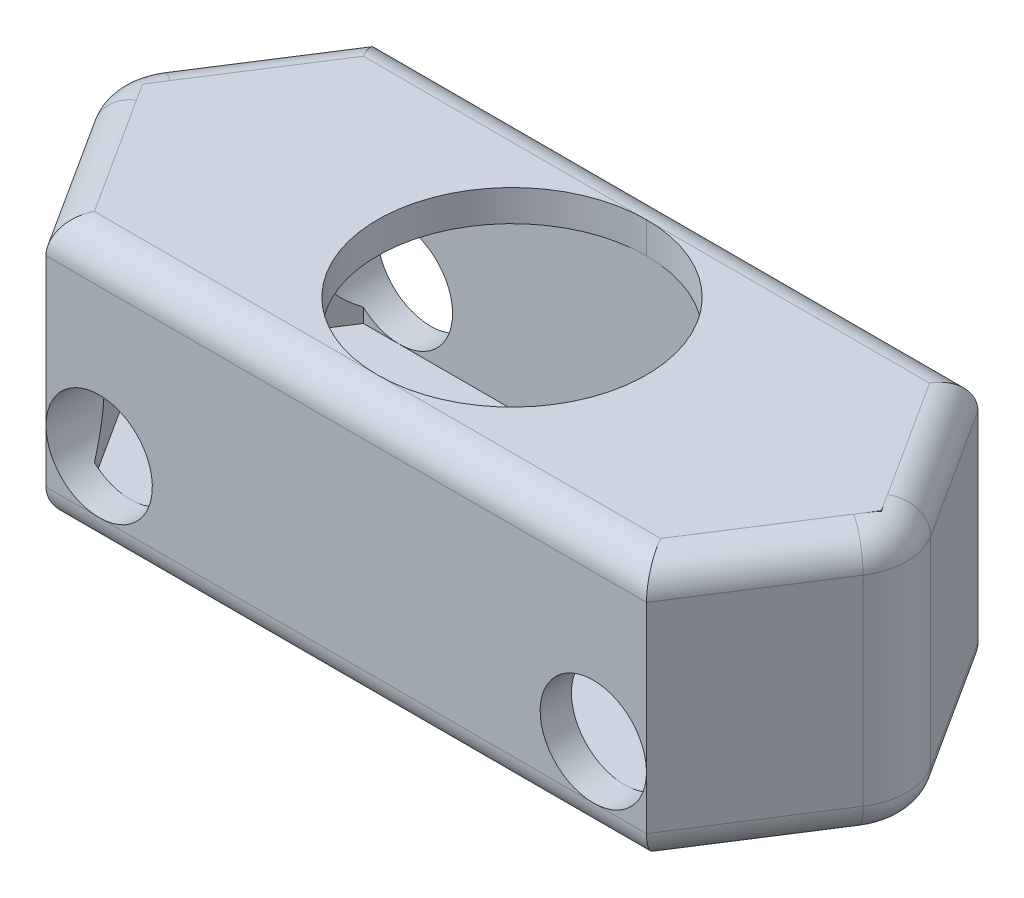
from build123d import *

# Parameters (mm, degrees)
SKETCH1_W           = 96
SKETCH1_H           = 53
BOSS_EXTRUDE1_DEPTH = 42
BOSS_EXTRUDE2_DEPTH = 42
SHELL5_T            = -5
CUT_EXTRUDE2_DEPTH  = 1
FILLET1_R           = 10
FILLET3_R           = 5
SKETCH10_R          = 8.5
CUT_EXTRUDE3_DEPTH  = 93.50423389
BOSS_EXTRUDE3_DEPTH = 5


with BuildPart() as part:
    # Sketch1 → Boss-Extrude1 (new body)
    with BuildSketch(Plane(origin=(0, 0, 0), x_dir=(1, 0, 0), z_dir=(0, 1, 0))):
        Rectangle(SKETCH1_W, SKETCH1_H)
    extrude(amount=BOSS_EXTRUDE1_DEPTH)

    # Sketch3 → Boss-Extrude2 (add)
    with BuildSketch(Plane.XZ):
        Polygon((48, -26.5), (65, 0), (48, 26.5), align=None)
        Polygon((-48, 26.5), (-65, 0), (-48, -26.5), align=None)
    extrude(amount=-BOSS_EXTRUDE2_DEPTH)

    # Shell5
    shell5_openings = [part.faces().sort_by_distance(p)[0] for p in [
        (0, 42, 0),
    ]]
    offset(amount=SHELL5_T, openings=shell5_openings, kind=Kind.INTERSECTION)

    # Sketch8 → Cut-Extrude2 (cut)
    # profile 1 of 6: a face of its own
    with BuildSketch(Plane(origin=(0, 5, 0), x_dir=(1, 0, 0), z_dir=(0, 1, 0))):
        with BuildLine():
            Line((-4.504844961, 1.050715732), (-4.844889031, 0.754842335))
            add(Edge.make_bspline(
                [(-4.844889031, 0.754842335), (-4.898237291, 0.80142613), (-5.002092405, 0.892112602), (-5.164707572, 1.011904887), (-5.328232657, 1.112946399), (-5.492710957, 1.194030907), (-5.655366137, 1.258974286), (-5.816939379, 1.303622633), (-5.976145971, 1.332792074), (-6.082014719, 1.336396961), (-6.134252012, 1.338175668)],
                knots=[0, 0, 0, 0, 1.174203348, 2.285866929, 3.345479548, 4.357773815, 5.323690501, 6.245291137, 7.134199255, 8, 8, 8, 8], degree=3))
            add(Edge.make_bspline(
                [(-6.134252012, 1.338175668), (-6.164425447, 1.337703009), (-6.224677975, 1.33675917), (-6.314573041, 1.32705374), (-6.403591616, 1.312576291), (-6.491787892, 1.291856595), (-6.579348454, 1.266309425), (-6.665603063, 1.233730987), (-6.751082461, 1.195622835), (-6.835093854, 1.151767526), (-6.916749529, 1.10311766), (-6.994357433, 1.049575964), (-7.067433723, 0.991229374), (-7.136115341, 0.928242973), (-7.199998931, 0.860520622), (-7.260031212, 0.789036584), (-7.314657361, 0.712115132), (-7.364940732, 0.631412765), (-7.409283677, 0.547502634), (-7.4491955, 0.462403933), (-7.482052164, 0.375394971), (-7.508642905, 0.286765424), (-7.529821721, 0.19663121), (-7.545195918, 0.10509162), (-7.554709821, 0.011856123), (-7.555651776, -0.050724059), (-7.556127012, -0.082297089)],
                knots=[0, 0, 0, 0, 0.9732313, 1.943419598, 2.914105962, 3.881741322, 4.864768402, 5.855028487, 6.854206409, 7.882911434, 8.911035887, 9.919250175, 10.922630637, 11.925982763, 12.923451909, 13.924676513, 14.935397504, 15.964931351, 16.990480746, 17.995899336, 18.995873688, 19.988284801, 20.979664002, 21.981342857, 22.981544644, 24, 24, 24, 24], degree=3))
            add(Edge.make_bspline(
                [(-7.556127012, -0.082297089), (-7.555323244, -0.114565214), (-7.553718473, -0.178990437), (-7.544809042, -0.274890791), (-7.528497956, -0.369028024), (-7.505840825, -0.461508241), (-7.477215568, -0.55244508), (-7.442108506, -0.642072739), (-7.399577984, -0.72949306), (-7.352412425, -0.815509258), (-7.299336438, -0.898062795), (-7.240728264, -0.975876351), (-7.178566575, -1.049955037), (-7.110985447, -1.118236594), (-7.040021935, -1.183005678), (-6.963202013, -1.241414846), (-6.882684206, -1.296335074), (-6.797932196, -1.34608716), (-6.709696089, -1.389964394), (-6.619438612, -1.428678329), (-6.526864896, -1.46104473), (-6.432546661, -1.487722765), (-6.33598914, -1.508009155), (-6.23789297, -1.522566827), (-6.137718233, -1.532259357), (-6.070239081, -1.533162313), (-6.036094961, -1.533619204)],
                knots=[0, 0, 0, 0, 0.993588149, 1.983757546, 2.962012758, 3.932297264, 4.913089422, 5.895147596, 6.892791648, 7.904042674, 8.913936126, 9.911190904, 10.901569418, 11.888649192, 12.866825019, 13.856968273, 14.856789458, 15.866221433, 16.879824684, 17.888846278, 18.887838639, 19.896937192, 20.90452114, 21.923117541, 22.949107649, 24, 24, 24, 24], degree=3))
            add(Edge.make_bspline(
                [(-6.036094961, -1.533619204), (-5.993517816, -1.532661036), (-5.909532796, -1.530771013), (-5.786255515, -1.516298439), (-5.667710131, -1.493952449), (-5.555104519, -1.45922165), (-5.446643138, -1.417912344), (-5.343943989, -1.365288635), (-5.245777372, -1.304273465), (-5.154252713, -1.233481521), (-5.068956983, -1.157234058), (-4.992997987, -1.075149092), (-4.925068022, -0.989889847), (-4.867795486, -0.899408773), (-4.818081684, -0.806241859), (-4.77870175, -0.70842484), (-4.748176229, -0.606788939), (-4.735551951, -0.536774242), (-4.729203935, -0.501567922)],
                knots=[0, 0, 0, 0, 1.125101743, 2.219305524, 3.276925285, 4.308813505, 5.329771737, 6.340890082, 7.353855978, 8.380572537, 9.395307413, 10.374367262, 11.333343716, 12.272376171, 13.200803521, 14.12078735, 15.055053215, 16, 16, 16, 16], degree=3))
            Line((-4.729203935, -0.501567922), (-5.850998807, -0.501567922))
            Line((-5.850998807, -0.501567922), (-5.850998807, -0.097721768))
            Line((-5.850998807, -0.097721768), (-4.280485986, -0.097721768))
            add(Edge.make_bspline(
                [(-4.280485986, -0.097721768), (-4.282076481, -0.166979619), (-4.285181305, -0.30217872), (-4.310107199, -0.499253927), (-4.346859218, -0.685616782), (-4.400553303, -0.860481135), (-4.468587171, -1.02409343), (-4.551679973, -1.176457554), (-4.649668462, -1.317529109), (-4.761891658, -1.446512604), (-4.886656716, -1.562209111), (-5.022640429, -1.663529065), (-5.17045244, -1.747621609), (-5.328204876, -1.817482365), (-5.496771134, -1.871460669), (-5.67571719, -1.909693061), (-5.865322582, -1.933344636), (-5.995358946, -1.936068611), (-6.062036467, -1.937465358)],
                knots=[0, 0, 0, 0, 1.147910205, 2.240849596, 3.288798376, 4.293882934, 5.268269983, 6.221997348, 7.165762291, 8.110600512, 9.051082397, 9.981847279, 10.915696266, 11.864665164, 12.837641225, 13.844673414, 14.894833504, 16, 16, 16, 16], degree=3))
            add(Edge.make_bspline(
                [(-6.062036467, -1.937465358), (-6.101312704, -1.93689133), (-6.17900529, -1.935755842), (-6.293863565, -1.927799643), (-6.405779156, -1.91550493), (-6.514289413, -1.897048393), (-6.619980393, -1.874214174), (-6.721991429, -1.845011157), (-6.821710606, -1.812651713), (-6.917373596, -1.772649068), (-7.011018082, -1.729723801), (-7.101091085, -1.680322556), (-7.187675247, -1.625297485), (-7.272603276, -1.56682626), (-7.352611253, -1.501214497), (-7.430382652, -1.431597493), (-7.504719178, -1.356563159), (-7.551490311, -1.303197391), (-7.5750573, -1.276307505)],
                knots=[0, 0, 0, 0, 1.103516608, 2.18287355, 3.233646581, 4.265703846, 5.274262808, 6.270085734, 7.246073526, 8.217965859, 9.181570311, 10.139587173, 11.101556858, 12.063436887, 13.034641265, 14.006444858, 14.995489556, 16, 16, 16, 16], degree=3))
            add(Edge.make_bspline(
                [(-7.5750573, -1.276307505), (-7.609596255, -1.233717281), (-7.677932192, -1.149451764), (-7.764038984, -1.012957615), (-7.839634307, -0.873242149), (-7.899731359, -0.727370459), (-7.946946138, -0.57676553), (-7.980807873, -0.421013823), (-8.000506826, -0.260188672), (-8.00338962, -0.151293719), (-8.004844961, -0.096319524)],
                knots=[0, 0, 0, 0, 1.024988564, 2.027958144, 3.013741914, 3.99376912, 4.974186348, 5.962951834, 6.97162285, 8, 8, 8, 8], degree=3))
            add(Edge.make_bspline(
                [(-8.004844961, -0.096319524), (-8.004320715, -0.05515282), (-8.003281848, 0.026424706), (-7.99039576, 0.147645552), (-7.971917469, 0.266919033), (-7.945219757, 0.384056757), (-7.910731033, 0.498819892), (-7.868335813, 0.611373239), (-7.818845173, 0.72210989), (-7.761016906, 0.829679495), (-7.698079219, 0.934058711), (-7.627346496, 1.032004894), (-7.552444113, 1.12536182), (-7.470749844, 1.211888286), (-7.384607799, 1.293991842), (-7.291520978, 1.36878542), (-7.193418685, 1.438491145), (-7.089458158, 1.501436466), (-6.981335503, 1.558001196), (-6.869279998, 1.607610728), (-6.753510518, 1.648436099), (-6.63483355, 1.683479445), (-6.512329174, 1.708965488), (-6.386636688, 1.727784797), (-6.257439745, 1.740440458), (-6.170039341, 1.74149069), (-6.12583855, 1.742021822)],
                knots=[0, 0, 0, 0, 1.010042427, 2.001538926, 2.988977894, 3.97147212, 4.947868168, 5.928132478, 6.921817128, 7.922678872, 8.924230854, 9.911186466, 10.885946514, 11.860014231, 12.829900618, 13.804660667, 14.788293046, 15.781961137, 16.785220236, 17.781814947, 18.787040195, 19.796447094, 20.816926666, 21.855387176, 22.915410262, 24, 24, 24, 24], degree=3))
            add(Edge.make_bspline(
                [(-6.12583855, 1.742021822), (-6.0886703, 1.741362413), (-6.014738586, 1.740050777), (-5.904729378, 1.733225006), (-5.796346998, 1.72066284), (-5.689830377, 1.701932393), (-5.584543247, 1.680087431), (-5.481456876, 1.651731491), (-5.380170028, 1.618683373), (-5.280185281, 1.580720478), (-5.181089387, 1.537191003), (-5.082604324, 1.487407794), (-4.985150588, 1.430129768), (-4.887700484, 1.36716041), (-4.790864231, 1.297620535), (-4.694795959, 1.221467896), (-4.598331025, 1.139758952), (-4.536340817, 1.080714775), (-4.504844961, 1.050715732)],
                knots=[0, 0, 0, 0, 0.985310127, 1.959889608, 2.920407961, 3.875718043, 4.825872088, 5.769643135, 6.708031182, 7.649175746, 8.603380435, 9.575831151, 10.572468945, 11.59831001, 12.650450436, 13.731164539, 14.847254788, 16, 16, 16, 16], degree=3))
        make_face()
    # profile 2 of 6: a face of its own
    with BuildSketch(Plane(origin=(0, 5, 0), x_dir=(1, 0, 0), z_dir=(0, 1, 0))):
        with BuildLine():
            Line((-3.786896243, 0.754842335), (-3.338178294, 0.754842335))
            Line((-3.338178294, 0.754842335), (-3.338178294, 0.385351149))
            add(Edge.make_bspline(
                [(-3.338178294, 0.385351149), (-3.335470725, 0.402244248), (-3.330185935, 0.435217183), (-3.316855338, 0.482600846), (-3.298417404, 0.526592863), (-3.275242101, 0.567243287), (-3.247757728, 0.604706519), (-3.215685363, 0.638748525), (-3.179174199, 0.669846129), (-3.123935918, 0.705390246), (-3.051411669, 0.742984714), (-2.960413182, 0.775611026), (-2.867254902, 0.796279893), (-2.804028587, 0.79856836), (-2.772373005, 0.799714129)],
                knots=[0, 0, 0, 0, 0.801625561, 1.56465941, 2.301277113, 3.032414989, 3.753384473, 4.4742707, 5.220602463, 5.995500889, 7.548895402, 9.039144265, 10.517585467, 12, 12, 12, 12], degree=3))
            add(Edge.make_bspline(
                [(-2.772373005, 0.799714129), (-2.743742012, 0.798013917), (-2.683591827, 0.794441982), (-2.591198392, 0.770626643), (-2.493908609, 0.731320776), (-2.429647123, 0.696186098), (-2.395870602, 0.677718937)],
                knots=[0, 0, 0, 0, 0.858860638, 1.804360244, 2.845948385, 4, 4, 4, 4], degree=3))
            Line((-2.395870602, 0.677718937), (-2.608310505, 0.351697302))
            add(Edge.make_bspline(
                [(-2.608310505, 0.351697302), (-2.632542851, 0.358552163), (-2.676810829, 0.371074714), (-2.737830117, 0.383831998), (-2.786108699, 0.393500608), (-2.814412174, 0.395165293), (-2.826359384, 0.395867976)],
                knots=[0, 0, 0, 0, 1.354987806, 2.475310119, 3.356411532, 4, 4, 4, 4], degree=3))
            add(Edge.make_bspline(
                [(-2.826359384, 0.395867976), (-2.84593579, 0.394432401), (-2.887139381, 0.391410864), (-2.948603568, 0.367662559), (-3.011710373, 0.331022657), (-3.063702227, 0.289996521), (-3.105412277, 0.249895781), (-3.13525361, 0.21311188), (-3.164215805, 0.171481741), (-3.191404737, 0.124583792), (-3.216496548, 0.072378607), (-3.240226518, 0.01546831), (-3.263021214, -0.04636211), (-3.275589176, -0.089919916), (-3.28208855, -0.112445326)],
                knots=[0, 0, 0, 0, 0.965356871, 2.031842204, 3.216327082, 4.56533618, 5.292082419, 6.07124699, 6.900886396, 7.796081313, 8.746333432, 9.760722644, 10.841983902, 12, 12, 12, 12], degree=3))
            add(Edge.make_bspline(
                [(-3.28208855, -0.112445326), (-3.286834237, -0.131079638), (-3.297481896, -0.172888507), (-3.307506235, -0.243863219), (-3.317599064, -0.328672551), (-3.324698842, -0.427655735), (-3.33124245, -0.540530139), (-3.334964515, -0.667715821), (-3.338051018, -0.80911138), (-3.338134558, -0.90821632), (-3.338178294, -0.960101576)],
                knots=[0, 0, 0, 0, 0.541796663, 1.215601946, 2.018210726, 2.950106988, 4.012619945, 5.205915212, 6.537188929, 8, 8, 8, 8], degree=3))
            Line((-3.338178294, -0.960101576), (-3.338178294, -1.847721768))
            Line((-3.338178294, -1.847721768), (-3.786896243, -1.847721768))
            Line((-3.786896243, -1.847721768), (-3.786896243, 0.754842335))
        make_face()
    # profile 3 of 6: a face of its own
    with BuildSketch(Plane(origin=(0, 5, 0), x_dir=(1, 0, 0), z_dir=(0, 1, 0))):
        with BuildLine():
            add(Edge.make_bspline(
                [(-0.936135025, 0.799714129), (-0.884195082, 0.798291761), (-0.782506477, 0.795507031), (-0.633709237, 0.77591514), (-0.492411144, 0.74187489), (-0.358207229, 0.6952846), (-0.231649809, 0.63424482), (-0.112422784, 0.560397227), (-0.000952425, 0.472305887), (0.06619315, 0.40475981), (0.100122988, 0.370627591)],
                knots=[0, 0, 0, 0, 1.078775739, 2.112039281, 3.110494877, 4.093081892, 5.057110616, 6.022958758, 7.000966324, 8, 8, 8, 8], degree=3))
            add(Edge.make_bspline(
                [(0.100122988, 0.370627591), (0.13021185, 0.336796518), (0.189368899, 0.27028199), (0.265806212, 0.162990899), (0.33090196, 0.052621671), (0.383566168, -0.061657768), (0.425543347, -0.179324841), (0.454654824, -0.30084449), (0.472987033, -0.425986824), (0.474937256, -0.510618542), (0.47592427, -0.553450935)],
                knots=[0, 0, 0, 0, 1.062178036, 2.088324843, 3.086640365, 4.066023852, 5.037709567, 6.014384934, 6.995073642, 8, 8, 8, 8], degree=3))
            add(Edge.make_bspline(
                [(0.47592427, -0.553450935), (0.474690646, -0.596519673), (0.472245773, -0.681875925), (0.453321056, -0.807965307), (0.423391271, -0.930696163), (0.380336456, -1.049508192), (0.324925915, -1.164530307), (0.258450155, -1.276462181), (0.178301725, -1.383814027), (0.088186823, -1.486897105), (-0.01195635, -1.581995664), (-0.121245752, -1.665253544), (-0.238341583, -1.73571187), (-0.363032406, -1.793708796), (-0.49591289, -1.837533229), (-0.63569579, -1.86998796), (-0.78345953, -1.889154574), (-0.884429179, -1.891428898), (-0.936135025, -1.892593563)],
                knots=[0, 0, 0, 0, 0.952871876, 1.888459614, 2.815544184, 3.744891397, 4.679563604, 5.637601804, 6.621431805, 7.640342292, 8.664856555, 9.672479278, 10.67487095, 11.683873433, 12.709444777, 13.765907845, 14.855937143, 16, 16, 16, 16], degree=3))
            add(Edge.make_bspline(
                [(-0.936135025, -1.892593563), (-0.985516405, -1.891459371), (-1.082318207, -1.889236025), (-1.223775246, -1.86949758), (-1.358664949, -1.839374485), (-1.486003605, -1.794560134), (-1.606840221, -1.738518909), (-1.720366458, -1.669010911), (-1.82745674, -1.587689791), (-1.925317509, -1.49360085), (-2.014514763, -1.392451864), (-2.091936553, -1.285068792), (-2.158526587, -1.173948191), (-2.212663327, -1.058150142), (-2.254149088, -0.937716278), (-2.284524656, -0.813640471), (-2.302262737, -0.68483745), (-2.304826306, -0.59767534), (-2.306127012, -0.553450935)],
                knots=[0, 0, 0, 0, 1.108842573, 2.173652473, 3.202745058, 4.208988794, 5.200203338, 6.189803525, 7.193715926, 8.215010613, 9.234454675, 10.219573757, 11.184848795, 12.140854958, 13.08565054, 14.042002664, 15.006549187, 16, 16, 16, 16], degree=3))
            add(Edge.make_bspline(
                [(-2.306127012, -0.553450935), (-2.305067649, -0.509696353), (-2.302980495, -0.423491168), (-2.285871394, -0.296383806), (-2.256842548, -0.174252244), (-2.217709599, -0.056108086), (-2.166034772, 0.0571491), (-2.103211488, 0.16615839), (-2.029807866, 0.271322269), (-1.972588691, 0.335873833), (-1.943647044, 0.368524226)],
                knots=[0, 0, 0, 0, 1.034079547, 2.037341334, 3.024980457, 3.998111168, 4.974764182, 5.962233312, 6.969290918, 8, 8, 8, 8], degree=3))
            add(Edge.make_bspline(
                [(-1.943647044, 0.368524226), (-1.909978016, 0.402917948), (-1.843601464, 0.470723196), (-1.733118495, 0.558632585), (-1.616553227, 0.63358708), (-1.492732935, 0.693858539), (-1.363102682, 0.742285045), (-1.226388804, 0.775660388), (-1.083253779, 0.795501361), (-0.985744467, 0.798293555), (-0.936135025, 0.799714129)],
                knots=[0, 0, 0, 0, 1.021997278, 2.014808882, 2.992991082, 3.961403697, 4.935644248, 5.92819495, 6.945935601, 8, 8, 8, 8], degree=3))
        make_face()
        with BuildLine():
            add(Edge.make_bspline(
                [(-0.937537268, 0.395867976), (-0.967496606, 0.395069649), (-1.02698247, 0.39348453), (-1.114600278, 0.380513622), (-1.199760904, 0.35953847), (-1.281529851, 0.329086114), (-1.361141348, 0.29102986), (-1.437257433, 0.24362923), (-1.511593554, 0.188807943), (-1.58144352, 0.125326369), (-1.646431942, 0.056217401), (-1.702739155, -0.018728975), (-1.750908401, -0.097411426), (-1.789484923, -0.180823121), (-1.819964892, -0.268397832), (-1.841292182, -0.360303824), (-1.855349104, -0.456497849), (-1.856713, -0.522082963), (-1.857409063, -0.5555543)],
                knots=[0, 0, 0, 0, 0.976916649, 1.939720157, 2.882730922, 3.833047911, 4.780976627, 5.756404754, 6.753607, 7.790049989, 8.831165002, 9.84360893, 10.842529111, 11.835057585, 12.835634664, 13.861933882, 14.908838789, 16, 16, 16, 16], degree=3))
            add(Edge.make_bspline(
                [(-1.857409063, -0.5555543), (-1.855815339, -0.599147441), (-1.852678846, -0.684939901), (-1.827049168, -0.810604058), (-1.786373498, -0.930701367), (-1.729581832, -1.043664747), (-1.660155774, -1.147013083), (-1.579228862, -1.237488909), (-1.489895401, -1.315812421), (-1.390430691, -1.378709174), (-1.284244991, -1.427937838), (-1.172775449, -1.462984085), (-1.056650627, -1.484887317), (-0.977598054, -1.487449164), (-0.937537268, -1.488747409)],
                knots=[0, 0, 0, 0, 1.073737222, 2.11314337, 3.147909503, 4.191315005, 5.220292011, 6.207728104, 7.175628903, 8.139268678, 9.098074859, 10.052770626, 11.013219503, 12, 12, 12, 12], degree=3))
            add(Edge.make_bspline(
                [(-0.937537268, -1.488747409), (-0.894200963, -1.487266713), (-0.808804482, -1.484348924), (-0.683729603, -1.461158701), (-0.564283369, -1.423924129), (-0.451302754, -1.372030004), (-0.346450833, -1.306287244), (-0.252691202, -1.226498196), (-0.170518953, -1.13398563), (-0.100158788, -1.030866066), (-0.043339942, -0.918980808), (-0.002547079, -0.801557531), (0.022195995, -0.679746798), (0.025523457, -0.597267971), (0.027206321, -0.5555543)],
                knots=[0, 0, 0, 0, 1.042880454, 2.055051067, 3.051726387, 4.048830532, 5.040201766, 6.022282375, 7.002717173, 8.011000956, 9.020163719, 10.014978664, 10.996075346, 12, 12, 12, 12], degree=3))
            add(Edge.make_bspline(
                [(0.027206321, -0.5555543), (0.026475098, -0.523255117), (0.02503266, -0.459540652), (0.01126534, -0.365799059), (-0.011078755, -0.275533652), (-0.042830159, -0.189147578), (-0.083038475, -0.106340328), (-0.132509855, -0.027464914), (-0.191069027, 0.047854636), (-0.257825208, 0.118399295), (-0.330189445, 0.18326196), (-0.406651662, 0.240543221), (-0.487054943, 0.28811733), (-0.570284887, 0.328208493), (-0.657515531, 0.357999775), (-0.747850409, 0.37982529), (-0.841520237, 0.393722912), (-0.905236947, 0.395146372), (-0.937537268, 0.395867976)],
                knots=[0, 0, 0, 0, 1.02928639, 2.030405262, 3.013559112, 3.98951401, 4.959304921, 5.943474834, 6.952548865, 7.996299005, 9.035918103, 10.047849461, 11.03697177, 12.01024899, 12.98822153, 13.969594738, 14.97071361, 16, 16, 16, 16], degree=3))
        make_face(mode=Mode.SUBTRACT)
    # profile 4 of 6: a face of its own
    with BuildSketch(Plane(origin=(0, 5, 0), x_dir=(1, 0, 0), z_dir=(0, 1, 0))):
        with BuildLine():
            Line((1.014385809, 0.754842335), (1.463103757, 0.754842335))
            Line((1.463103757, 0.754842335), (1.463103757, -0.453190518))
            add(Edge.make_bspline(
                [(1.463103757, -0.453190518), (1.463235456, -0.487312347), (1.463488055, -0.552758584), (1.46546748, -0.646731842), (1.469244976, -0.731783604), (1.472755449, -0.808076051), (1.479599329, -0.87532378), (1.485845074, -0.934183544), (1.494933103, -0.984002994), (1.502464102, -1.01388599), (1.505872187, -1.027409268)],
                knots=[0, 0, 0, 0, 1.418944939, 2.721560048, 3.90822129, 4.959445687, 5.896519748, 6.718644391, 7.420134194, 8, 8, 8, 8], degree=3))
            add(Edge.make_bspline(
                [(1.505872187, -1.027409268), (1.518684689, -1.063706155), (1.543450482, -1.133865849), (1.599837919, -1.22818499), (1.667898458, -1.309359129), (1.74996263, -1.374800703), (1.841500812, -1.426648092), (1.94239236, -1.461548968), (2.050223438, -1.485543485), (2.1250572, -1.487659633), (2.16352443, -1.488747409)],
                knots=[0, 0, 0, 0, 1.064698082, 2.057997224, 3.027713519, 3.985869738, 4.951769774, 5.929245647, 6.93555818, 8, 8, 8, 8], degree=3))
            add(Edge.make_bspline(
                [(2.16352443, -1.488747409), (2.205468179, -1.487328592), (2.286491826, -1.484587833), (2.403001257, -1.461755451), (2.509617607, -1.424203157), (2.60440577, -1.369983364), (2.688400105, -1.305493551), (2.757363676, -1.229076512), (2.815051518, -1.145081699), (2.839636844, -1.082222622), (2.852026033, -1.050546287)],
                knots=[0, 0, 0, 0, 1.152522955, 2.226353534, 3.250900004, 4.246517978, 5.217118907, 6.149589309, 7.067529598, 8, 8, 8, 8], degree=3))
            add(Edge.make_bspline(
                [(2.852026033, -1.050546287), (2.856042979, -1.037290438), (2.864957384, -1.007873062), (2.872914348, -0.957635874), (2.88191203, -0.898156245), (2.887367182, -0.828323021), (2.89348691, -0.748682517), (2.896457339, -0.658869716), (2.898677132, -0.559305816), (2.898889849, -0.489650733), (2.899001193, -0.453190518)],
                knots=[0, 0, 0, 0, 0.552623276, 1.226381414, 2.027670893, 2.955584593, 4.022320098, 5.218031084, 6.543807858, 8, 8, 8, 8], degree=3))
            Line((2.899001193, -0.453190518), (2.899001193, 0.754842335))
            Line((2.899001193, 0.754842335), (3.347719142, 0.754842335))
            Line((3.347719142, 0.754842335), (3.347719142, -0.514188114))
            add(Edge.make_bspline(
                [(3.347719142, -0.514188114), (3.347259102, -0.555792017), (3.346364438, -0.636701438), (3.341092183, -0.754147965), (3.330916877, -0.864008951), (3.318570729, -0.966252111), (3.299501689, -1.060518388), (3.279383602, -1.1474747), (3.253933626, -1.226680026), (3.224337152, -1.298867955), (3.190385615, -1.365368071), (3.152068009, -1.427484962), (3.109920219, -1.486714033), (3.06321905, -1.542694969), (3.011390579, -1.594682041), (2.95607159, -1.644160302), (2.895568219, -1.689511092), (2.831077654, -1.731688893), (2.762151501, -1.769895727), (2.688550991, -1.802412941), (2.61119183, -1.830935713), (2.529149107, -1.852916712), (2.443133708, -1.871462589), (2.352667179, -1.883863024), (2.258049169, -1.890712785), (2.193683691, -1.891956576), (2.160719943, -1.892593563)],
                knots=[0, 0, 0, 0, 1.433126784, 2.78708125, 4.047948649, 5.23317835, 6.332013834, 7.359028814, 8.306074614, 9.194073739, 10.043734443, 10.874888521, 11.705886645, 12.545920784, 13.382708552, 14.23240739, 15.100217466, 15.98441358, 16.885165303, 17.811245298, 18.753488952, 19.72218431, 20.734230158, 21.782757764, 22.864474903, 24, 24, 24, 24], degree=3))
            add(Edge.make_bspline(
                [(2.160719943, -1.892593563), (2.129616556, -1.892341735), (2.068709324, -1.8918486), (1.979577801, -1.883531288), (1.894077431, -1.871888543), (1.812291212, -1.855185502), (1.734227335, -1.83351862), (1.660189926, -1.806728357), (1.589847553, -1.775142195), (1.523303489, -1.738740752), (1.460920121, -1.697922505), (1.402291215, -1.653741426), (1.348306146, -1.605230173), (1.298473711, -1.552951155), (1.251675873, -1.497836468), (1.210647633, -1.437624045), (1.172575625, -1.374613724), (1.138331764, -1.307098294), (1.108569517, -1.233288896), (1.083762193, -1.151516314), (1.061998601, -1.061897956), (1.044780904, -0.963727984), (1.030790009, -0.857544707), (1.021114395, -0.74267263), (1.015705298, -0.619643051), (1.014834305, -0.53475972), (1.014385809, -0.491051095)],
                knots=[0, 0, 0, 0, 1.07579807, 2.106647768, 3.094742466, 4.060581056, 4.992547774, 5.895540969, 6.78231141, 7.658099749, 8.517151737, 9.359794672, 10.195893314, 11.025198922, 11.857652707, 12.69437682, 13.543128465, 14.403853537, 15.310857085, 16.293043939, 17.358059167, 18.500139289, 19.739904812, 21.062881797, 22.487601799, 24, 24, 24, 24], degree=3))
            Line((1.014385809, -0.491051095), (1.014385809, 0.754842335))
        make_face()
    # profile 5 of 6: a face of its own
    with BuildSketch(Plane(origin=(0, 5, 0), x_dir=(1, 0, 0), z_dir=(0, 1, 0))):
        with BuildLine():
            Line((4.06566786, 0.754842335), (4.514385809, 0.754842335))
            Line((4.514385809, 0.754842335), (4.514385809, 0.290699706))
            add(Edge.make_bspline(
                [(4.514385809, 0.290699706), (4.521116568, 0.311469509), (4.534429143, 0.352549503), (4.563288667, 0.410264697), (4.596755917, 0.464524132), (4.636367046, 0.514531323), (4.681514727, 0.560648634), (4.733275773, 0.601787146), (4.790190228, 0.640146198), (4.874927367, 0.684268048), (4.987986664, 0.73134088), (5.131887309, 0.771040293), (5.28290101, 0.795652328), (5.386018575, 0.798344756), (5.438464334, 0.799714129)],
                knots=[0, 0, 0, 0, 0.694622356, 1.37387354, 2.049401652, 2.722628407, 3.401757179, 4.100556256, 4.825325589, 5.584715007, 7.140148756, 8.717099778, 10.330311678, 12, 12, 12, 12], degree=3))
            add(Edge.make_bspline(
                [(5.438464334, 0.799714129), (5.486907781, 0.798547046), (5.582536501, 0.796243191), (5.722623658, 0.776676181), (5.857377872, 0.74614675), (5.985730594, 0.701658531), (6.108773616, 0.645088472), (6.226149069, 0.57658227), (6.336851319, 0.494004873), (6.440973151, 0.401235573), (6.535381026, 0.299326132), (6.619573048, 0.192972542), (6.689923191, 0.08141584), (6.748319232, -0.034060327), (6.792001573, -0.154591958), (6.824973629, -0.278795434), (6.844118479, -0.407721154), (6.846509903, -0.495196197), (6.847719142, -0.539428499)],
                knots=[0, 0, 0, 0, 1.076228782, 2.124505721, 3.137534021, 4.142835799, 5.137588531, 6.143359867, 7.157306602, 8.202064418, 9.238473371, 10.241181928, 11.212440163, 12.164848115, 13.111430887, 14.056330489, 15.017171362, 16, 16, 16, 16], degree=3))
            add(Edge.make_bspline(
                [(6.847719142, -0.539428499), (6.846535382, -0.58460153), (6.844194028, -0.673949117), (6.824683169, -0.805499139), (6.793252237, -0.932409464), (6.748630791, -1.054528245), (6.691671733, -1.172054898), (6.621772428, -1.284730156), (6.539224477, -1.392397597), (6.445128681, -1.493786214), (6.342482832, -1.587141515), (6.232538842, -1.669182689), (6.116395283, -1.738172974), (5.994132954, -1.794488001), (5.866303724, -1.839156532), (5.731953859, -1.869458036), (5.592127532, -1.889173963), (5.49672585, -1.89144189), (5.448280039, -1.892593563)],
                knots=[0, 0, 0, 0, 1.000690261, 1.979261891, 2.940227073, 3.893808351, 4.855122405, 5.829614775, 6.827190625, 7.857089307, 8.891134036, 9.89799758, 10.891950105, 11.879132496, 12.876641118, 13.886749785, 14.926872999, 16, 16, 16, 16], degree=3))
            add(Edge.make_bspline(
                [(5.448280039, -1.892593563), (5.396546805, -1.890894056), (5.294626883, -1.88754585), (5.144808894, -1.863480404), (5.002057539, -1.822256277), (4.888504598, -1.776323491), (4.80451283, -1.730507066), (4.746246238, -1.693275233), (4.693658943, -1.651934569), (4.646630342, -1.606943176), (4.604795585, -1.559031685), (4.568647569, -1.507431919), (4.538563422, -1.451934762), (4.522460679, -1.412946081), (4.514385809, -1.393394845)],
                knots=[0, 0, 0, 0, 1.656042569, 3.26257835, 4.842282913, 6.405528061, 7.172280682, 7.902838742, 8.616847869, 9.310130132, 9.983752423, 10.650062733, 11.323061395, 12, 12, 12, 12], degree=3))
            Line((4.514385809, -1.393394845), (4.514385809, -2.79002946))
            Line((4.514385809, -2.79002946), (4.06566786, -2.79002946))
            Line((4.06566786, -2.79002946), (4.06566786, 0.754842335))
        make_face()
        with BuildLine():
            add(Edge.make_bspline(
                [(5.43285536, 0.395867976), (5.401956427, 0.395109693), (5.341062837, 0.393615319), (5.251476043, 0.38025155), (5.165116099, 0.36046046), (5.08194071, 0.331180077), (5.002363048, 0.293439793), (4.926134394, 0.247190986), (4.852618119, 0.19389145), (4.783974773, 0.131895481), (4.721312049, 0.063414656), (4.664966327, -0.009552018), (4.618926986, -0.088583214), (4.580866803, -0.172022453), (4.550275971, -0.259901042), (4.529658996, -0.353090255), (4.516651153, -0.450951427), (4.515151336, -0.517884915), (4.514385809, -0.552048691)],
                knots=[0, 0, 0, 0, 1.005723403, 1.982013728, 2.943867151, 3.887478966, 4.847584166, 5.806995223, 6.787400874, 7.800641986, 8.813368399, 9.807417327, 10.796880851, 11.78458637, 12.790712903, 13.821019732, 14.887818371, 16, 16, 16, 16], degree=3))
            add(Edge.make_bspline(
                [(4.514385809, -0.552048691), (4.515797357, -0.59702121), (4.518552085, -0.684787985), (4.542141775, -0.81249154), (4.581636965, -0.931713596), (4.63575759, -1.042441105), (4.70383388, -1.142951582), (4.784739442, -1.231868293), (4.876430961, -1.310311778), (4.980218143, -1.373675515), (5.090145396, -1.42478522), (5.203941366, -1.461174823), (5.31990438, -1.485156493), (5.398382982, -1.487547574), (5.437763213, -1.488747409)],
                knots=[0, 0, 0, 0, 1.102029977, 2.150682694, 3.17089293, 4.172933106, 5.163105818, 6.136792055, 7.112634256, 8.111227658, 9.108587182, 10.078099529, 11.035598473, 12, 12, 12, 12], degree=3))
            add(Edge.make_bspline(
                [(5.437763213, -1.488747409), (5.479465251, -1.487278097), (5.562120478, -1.484365859), (5.683941091, -1.460595058), (5.801123674, -1.420515101), (5.913945637, -1.367063394), (6.018956286, -1.298476885), (6.113728002, -1.216183471), (6.197940834, -1.121794098), (6.268486632, -1.015296304), (6.326808505, -0.902199079), (6.36825086, -0.784482669), (6.394055468, -0.664411661), (6.397349985, -0.583491289), (6.399001193, -0.542934108)],
                knots=[0, 0, 0, 0, 1.003862332, 1.989698134, 2.97583922, 3.980411469, 4.988981437, 5.986622354, 6.995396503, 8.025784312, 9.055403073, 10.052376809, 11.023853872, 12, 12, 12, 12], degree=3))
            add(Edge.make_bspline(
                [(6.399001193, -0.542934108), (6.397367626, -0.502140827), (6.394117604, -0.4209816), (6.368317147, -0.301205859), (6.327524466, -0.184385986), (6.269959717, -0.072596663), (6.199717729, 0.032175472), (6.117484207, 0.126616218), (6.022119784, 0.20693195), (5.917136033, 0.274969556), (5.803870432, 0.328684606), (5.684739729, 0.367701468), (5.560478034, 0.391561665), (5.475728585, 0.394421325), (5.43285536, 0.395867976)],
                knots=[0, 0, 0, 0, 0.980928904, 1.951581945, 2.935231878, 3.951401631, 4.96844259, 5.964697687, 6.954166899, 7.958816287, 8.967613111, 9.961818216, 10.968920427, 12, 12, 12, 12], degree=3))
        make_face(mode=Mode.SUBTRACT)
    # profile 6 of 6: a face of its own
    with BuildSketch(Plane(origin=(0, 5, 0), x_dir=(1, 0, 0), z_dir=(0, 1, 0))):
        Polygon((10.484437892, 1.742021822), (10.661821706, 1.742021822), (10.661821706, -0.636183306), (11.06566786, -0.636183306), (11.06566786, -1.04002946), (10.661821706, -1.04002946), (10.661821706, -1.847721768), (10.213103757, -1.847721768), (10.213103757, -1.04002946), (8.597719142, -1.04002946), align=None)
        Polygon((10.213103757, -0.636183306), (10.213103757, 0.755543456), (9.321977956, -0.636183306), align=None, mode=Mode.SUBTRACT)
    extrude(amount=-CUT_EXTRUDE2_DEPTH, mode=Mode.SUBTRACT)

    # Fillet1
    fillet1_edges = [part.edges().sort_by_distance(p)[0] for p in [
        (65, 21, 0),
        (-65, 21, 0),
    ]]
    fillet(fillet1_edges, radius=FILLET1_R)

    # Fillet3
    # the kernel refuses this fillet: 5 mm, written as the material it takes off along each edge
    with BuildSketch(Plane(origin=(41.250566321, 42, -37.021176028), x_dir=(-0.8416940822656768, 0, 0.5399546942836412), z_dir=(0.5399546942836411, 0, 0.8416940822656767)), Plane(origin=(-41.250566321, 42, 37.021176028), x_dir=(0.8416940822656762, 0, -0.5399546942836418), z_dir=(-0.5399546942836418, 0, -0.8416940822656762)), Plane(origin=(-61.536139697, 0, -5.399546943), x_dir=(0, 1, 0), z_dir=(0.5399546942836416, 0, -0.8416940822656763)), Plane(origin=(61.536139697, 42, 5.399546943), x_dir=(-0.8416940822656767, 0, -0.5399546942836412), z_dir=(-0.5399546942836412, 0, 0.8416940822656767))) as fillet3_piece_1:
        with BuildLine():
            CenterArc((FILLET3_R, FILLET3_R), FILLET3_R, 180, 90)
            Line((0, FILLET3_R), (0, 0))
            Line((0, 0), (FILLET3_R, 0))
        make_face()
    extrude(amount=37.569028643, mode=Mode.SUBTRACT)
    with BuildSketch(Plane(origin=(41.250566321, 0, -37.021176028), x_dir=(-0.8416940822656768, 0, 0.5399546942836412), z_dir=(0.5399546942836411, 0, 0.8416940822656767)), Plane(origin=(-41.250566321, 0, 37.021176028), x_dir=(0.8416940822656762, 0, -0.5399546942836418), z_dir=(-0.5399546942836418, 0, -0.8416940822656762)), Plane(origin=(61.536139697, 0, 5.399546943), x_dir=(-0.8416940822656767, 0, -0.5399546942836412), z_dir=(-0.5399546942836412, 0, 0.8416940822656767)), Plane(origin=(-61.536139697, 42, -5.399546943), x_dir=(0, -1, 0), z_dir=(0.5399546942836416, 0, -0.8416940822656763))) as fillet3_piece_2:
        with BuildLine():
            CenterArc((FILLET3_R, -FILLET3_R), FILLET3_R, 90, 90)
            Line((0, -FILLET3_R), (0, 0))
            Line((0, 0), (FILLET3_R, 0))
        make_face()
    extrude(amount=37.569028643, mode=Mode.SUBTRACT)
    with BuildSketch(Plane(origin=(60.5, 42, 26.5), x_dir=(0, 0, -1), z_dir=(-1, 0, 0))) as fillet3_piece_3:
        with BuildLine():
            CenterArc((FILLET3_R, FILLET3_R), FILLET3_R, 180, 90)
            Line((0, FILLET3_R), (0, 0))
            Line((0, 0), (FILLET3_R, 0))
        make_face()
    extrude(amount=121, mode=Mode.SUBTRACT)
    with BuildSketch(Plane(origin=(-53.119198874, 0, 0), x_dir=(-0.8416940822656761, 0, -0.5399546942836418), z_dir=(0.5399546942836418, 0, -0.8416940822656761))) as fillet3_piece_4:
        with BuildLine():
            CenterArc((10 - FILLET3_R, FILLET3_R), FILLET3_R, 270, 90)
            Line((10, FILLET3_R), (10, 0))
            Line((10, 0), (10 - FILLET3_R, 0))
        make_face()
    revolve(axis=Axis((-53.119198874, 0, 0), (0, 1, 0)), revolution_arc=65.361109487, mode=Mode.SUBTRACT)
    with BuildSketch(Plane(origin=(53.119198874, 0, 0), x_dir=(0.8416940822656761, 0, -0.5399546942836418), z_dir=(-0.5399546942836418, 0, -0.8416940822656761))) as fillet3_piece_5:
        with BuildLine():
            CenterArc((10 - FILLET3_R, -FILLET3_R), FILLET3_R, 0, 90)
            Line((10, -FILLET3_R), (10, 0))
            Line((10, 0), (10 - FILLET3_R, 0))
        make_face()
    revolve(axis=Axis((53.119198874, 0, 0), (0, -1, 0)), revolution_arc=65.361109487, mode=Mode.SUBTRACT)
    with BuildSketch(Plane(origin=(-53.119198874, 42, 0), x_dir=(-0.8416940822656761, 0, -0.5399546942836418), z_dir=(0.5399546942836418, 0, -0.8416940822656761))) as fillet3_piece_6:
        with BuildLine():
            CenterArc((10 - FILLET3_R, -FILLET3_R), FILLET3_R, 0, 90)
            Line((10 - FILLET3_R, 0), (10, 0))
            Line((10, 0), (10, -FILLET3_R))
        make_face()
    revolve(axis=Axis((-53.119198874, 42, 0), (0, 1, 0)), revolution_arc=65.361109487, mode=Mode.SUBTRACT)
    with BuildSketch(Plane(origin=(53.119198874, 42, 0), x_dir=(0.8416940822656761, 0, -0.5399546942836418), z_dir=(-0.5399546942836418, 0, -0.8416940822656761))) as fillet3_piece_7:
        with BuildLine():
            CenterArc((10 - FILLET3_R, FILLET3_R), FILLET3_R, 270, 90)
            Line((10, FILLET3_R), (10, 0))
            Line((10, 0), (10 - FILLET3_R, 0))
        make_face()
    revolve(axis=Axis((53.119198874, 42, 0), (0, -1, 0)), revolution_arc=65.361109487, mode=Mode.SUBTRACT)
    with BuildSketch(Plane(origin=(60.5, 0, 26.5), x_dir=(0, 0, -1), z_dir=(-1, 0, 0)), Plane(origin=(-60.5, 0, -26.5), x_dir=(0, 0, 1), z_dir=(1, 0, 0)), Plane(origin=(-60.5, 42, -26.5), x_dir=(0, -1, 0), z_dir=(1, 0, 0))) as fillet3_piece_8:
        with BuildLine():
            CenterArc((FILLET3_R, -FILLET3_R), FILLET3_R, 90, 90)
            Line((0, -FILLET3_R), (0, 0))
            Line((0, 0), (FILLET3_R, 0))
        make_face()
    extrude(amount=121, mode=Mode.SUBTRACT)

    # Sketch10 → Cut-Extrude3 (cut, through all)
    with BuildSketch(Plane.XY.offset(26.5)):
        with Locations(Location((-39.5, 13.5, 0), (0, 0, 270))):
            Circle(SKETCH10_R)
        with Locations(Location((39.5, 13.5, 0), (0, 0, 270))):
            Circle(SKETCH10_R)
    extrude(amount=-CUT_EXTRUDE3_DEPTH, mode=Mode.SUBTRACT)


with BuildPart() as body_2:
    # Sketch6 → Boss-Extrude3 (new body)
    with BuildSketch(Plane(origin=(0, 42, 0), x_dir=(1, 0, 0), z_dir=(0, 1, 0))):
        with BuildLine():
            Line((9e-09, 21.5), (-45.267146607, 21.5))
            Line((-45.267146607, 21.5), (-59.059599437, 0))
            Line((-59.059599437, 0), (-21.5, 0))
            ThreePointArc((-21.5, 0), (-15.202795792, 15.202795799), (9e-09, 21.5))
        make_face()
        with BuildLine():
            Line((-21.5, 0), (-59.059599437, 0))
            Line((-59.059599437, 0), (-45.267146607, -21.5))
            Line((-45.267146607, -21.5), (1.5e-08, -21.5))
            ThreePointArc((1.5e-08, -21.5), (-15.20279579, -15.202795801), (-21.5, 0))
        make_face()
        with BuildLine():
            Line((45.267146607, 21.5), (9e-09, 21.5))
            ThreePointArc((9e-09, 21.5), (15.202795799, 15.202795792), (21.5, 0))
            Line((21.5, 0), (59.059599437, 0))
            Line((59.059599437, 0), (45.267146607, 21.5))
        make_face()
        with BuildLine():
            Line((59.059599437, 0), (21.5, 0))
            ThreePointArc((21.5, 0), (15.202795801, -15.20279579), (1.5e-08, -21.5))
            Line((1.5e-08, -21.5), (45.267146607, -21.5))
            Line((45.267146607, -21.5), (59.059599437, 0))
        make_face()
    extrude(amount=-BOSS_EXTRUDE3_DEPTH)


solid = Compound([part.part, body_2.part])
